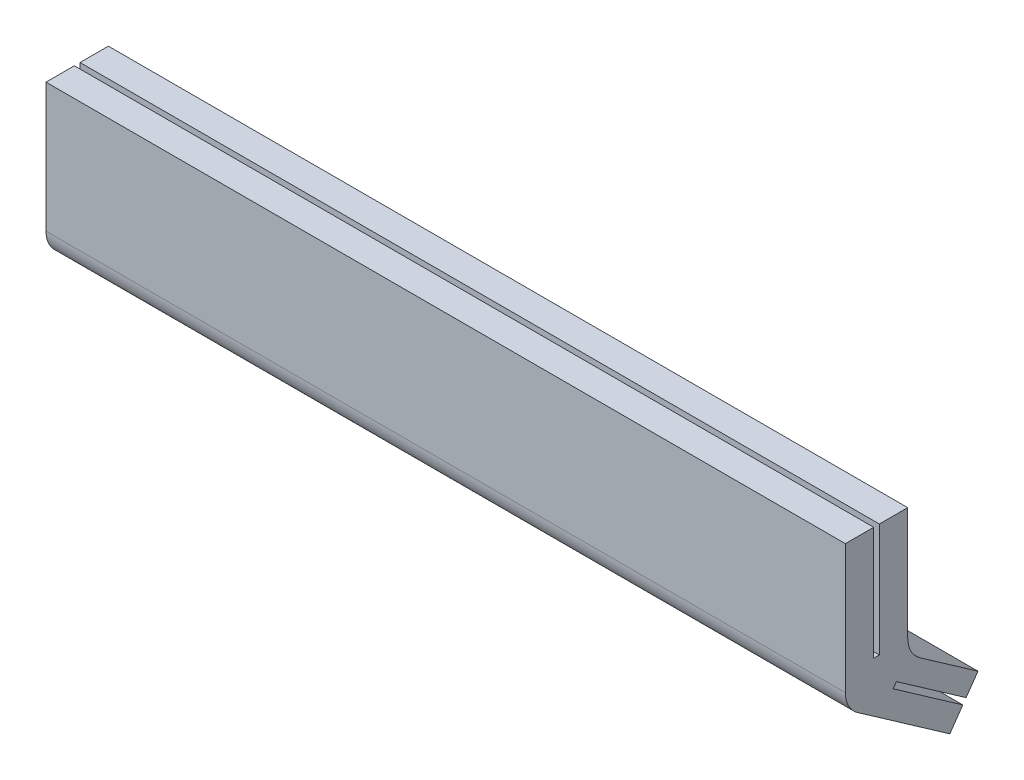
from build123d import *

# Parameters (mm, degrees)
BOSS_EXTRUDE1_DEPTH      = 141
BOSS_EXTRUDE1_DEPTH_BACK = 141
CAVITY1_START            = -2
CAVITY1_OUTLINE_W        = 282
CAVITY1_OUTLINE_H        = 40
CAVITY1_DEPTH            = 2


# Read off the part's stored shape, not the designer's step: Cavity1
with BuildPart() as part:
    # Sketch1 → Boss-Extrude1 (new, two sides: drawn at the far end of the back side and taken through both)
    with BuildSketch(Plane(origin=(0, 0, 0), x_dir=(0, 0, -1), z_dir=(1, 0, 0)).offset(-BOSS_EXTRUDE1_DEPTH_BACK)):
        with BuildLine():
            Line((12, -285), (-10, -285))
            Line((-10, -285), (-10, -330.531793911))
            ThreePointArc((-10, -330.531793911), (-8.870108332, -335.149280044), (-5.735764364, -338.723314354))
            Line((-5.735764364, -338.723314354), (26.861841993, -361.548404053))
            Line((26.861841993, -361.548404053), (31.450453484, -354.995187698))
            Line((31.450453484, -354.995187698), (6.875892155, -337.787894608))
            Line((6.875892155, -337.787894608), (8.023045028, -336.149590519))
            Line((8.023045028, -336.149590519), (32.597606357, -353.35688361))
            Line((32.597606357, -353.35688361), (36.795346904, -347.361888815))
            Line((36.795346904, -347.361888815), (16.264235636, -332.985849937))
            ThreePointArc((16.264235636, -332.985849937), (13.129891668, -329.411815627), (12, -324.794329494))
            Line((12, -324.794329494), (12, -285))
        make_face()
    extrude(amount=BOSS_EXTRUDE1_DEPTH + BOSS_EXTRUDE1_DEPTH_BACK)

    # Cavity1 outline → Cavity1 (cut)
    with BuildSketch(Plane.XY.offset(CAVITY1_START)):
        with Locations((0, -305)):
            Rectangle(CAVITY1_OUTLINE_W, CAVITY1_OUTLINE_H)
    extrude(amount=CAVITY1_DEPTH, mode=Mode.SUBTRACT)


solid = part.part
